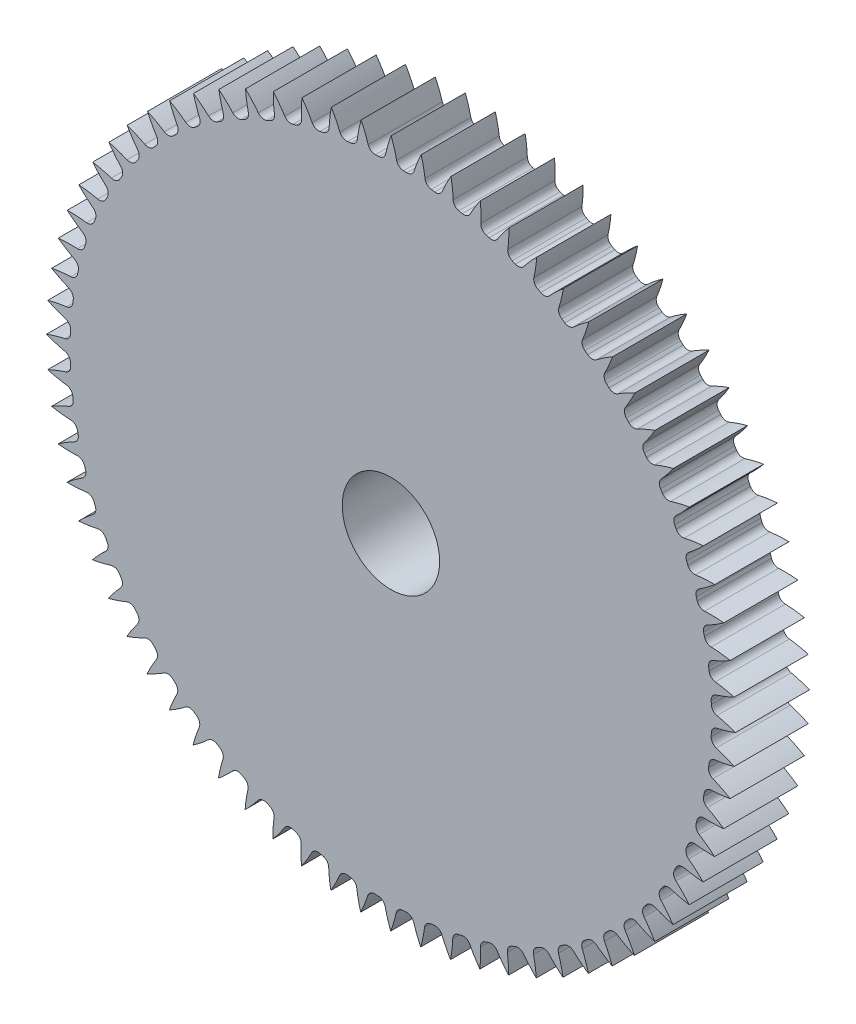
from build123d import *

# Parameters (mm, degrees)
SKETCH3_R             = 156.65
GEARBODY_DEPTH        = 25.4
TOOTHCUT_DEPTH        = 223.987903259
CIRPATTERN1_OUTLINE_R = 156.65
CIRPATTERN1_DEPTH     = 25.4
HUB1DIA_R             = 79.375
HUB1_DEPTH            = 17
BOREDIA_R             = 16.675100327
BORE_DEPTH            = 12700


# Read off the part's stored shape, not the designer's step: CirPattern1
with BuildPart() as part:
    # Sketch3 → gearBody (new body)
    with BuildSketch(Plane.XY):
        Circle(SKETCH3_R)
    extrude(amount=GEARBODY_DEPTH)

    # Sketch2 → toothCut (cut, through all)
    with BuildSketch(Plane.XY):
        with BuildLine():
            ThreePointArc((109.668319572, -5.460954122), (109.696421118, -4.863900865), (109.721272227, -4.266703485))
            ThreePointArc((109.721272227, -4.266703485), (110.294961179, -2.778743906), (111.659019101, -1.952615158))
            ThreePointArc((111.659019101, -1.952615158), (127.30239627, 4.746795303), (139.364241672, 16.751345908))
            ThreePointArc((139.364241672, 16.751345908), (140.229594831, -6.217731086), (137.334752586, -29.020082334))
            ThreePointArc((137.334752586, -29.020082334), (126.382707729, -15.9951039), (111.393653083, -7.937462149))
            ThreePointArc((111.393653083, -7.937462149), (110.108064896, -6.993849021), (109.668319572, -5.460954122))
        make_face()
    extrude(amount=TOOTHCUT_DEPTH, mode=Mode.SUBTRACT)

    # CirPattern1 outline → CirPattern1 (cut)
    with BuildSketch(Plane.XY):
        Circle(CIRPATTERN1_OUTLINE_R)
        with BuildLine():
            ThreePointArc((111.063941199, -11.676909612), (109.633072065, -12.381009209), (108.931881949, -13.813306366))
            ThreePointArc((108.931881949, -13.813306366), (108.855076224, -14.406065313), (108.775044994, -14.998397391))
            ThreePointArc((108.775044994, -14.998397391), (109.07951636, -16.563785493), (110.277971194, -17.615854281))
            ThreePointArc((110.277971194, -17.615854281), (113.276609926, -18.982931375), (116.167779807, -20.564661675))
            ThreePointArc((116.167779807, -20.564661675), (112.909314159, -21.057749544), (109.623599641, -21.312335734))
            ThreePointArc((109.623599641, -21.312335734), (108.136809072, -21.889047557), (107.313454274, -23.254781645))
            ThreePointArc((107.313454274, -23.254781645), (107.185278473, -23.838590906), (107.053926643, -24.4216938))
            ThreePointArc((107.053926643, -24.4216938), (107.220806841, -26.007661555), (108.323007355, -27.160179125))
            ThreePointArc((108.323007355, -27.160179125), (111.191086742, -28.783402664), (113.93339797, -30.611096061))
            ThreePointArc((113.93339797, -30.611096061), (110.644356328, -30.818313588), (107.348956297, -30.785562111))
            ThreePointArc((107.348956297, -30.785562111), (105.817559668, -31.230497036), (104.878306415, -32.519273994))
            ThreePointArc((104.878306415, -32.519273994), (104.699736032, -33.089690427), (104.518063269, -33.659126372))
            ThreePointArc((104.518063269, -33.659126372), (104.54608224, -35.253603609), (105.543640024, -36.497798606))
            ThreePointArc((105.543640024, -36.497798606), (108.259332249, -38.364814879), (110.83191418, -40.424561522))
            ThreePointArc((110.83191418, -40.424561522), (107.537328137, -40.344331657), (104.257322577, -40.024491772))
            ThreePointArc((104.257322577, -40.024491772), (102.692974741, -40.334263574), (101.644971317, -41.536275033))
            ThreePointArc((101.644971317, -41.536275033), (101.41736538, -42.088957424), (101.186754324, -42.640392669))
            ThreePointArc((101.186754324, -42.640392669), (101.075698827, -44.231244453), (101.961021863, -45.557647802))
            ThreePointArc((101.961021863, -45.557647802), (104.50365887, -47.654247687), (106.886932601, -49.930371662))
            ThreePointArc((106.886932601, -49.930371662), (103.611875946, -49.563305002), (100.37222768, -48.958810883))
            ThreePointArc((100.37222768, -48.958810883), (98.786834268, -49.131062013), (97.638056612, -50.237159938))
            ThreePointArc((97.638056612, -50.237159938), (97.36314734, -50.767902041), (97.085353081, -51.297139831))
            ThreePointArc((97.085353081, -51.297139831), (96.836068314, -52.872258819), (97.60241876, -54.27077579))
            ThreePointArc((97.60241876, -54.27077579), (99.952649545, -56.581002896), (102.128476924, -59.056181524))
            ThreePointArc((102.128476924, -59.056181524), (98.897874816, -58.405071668), (95.723239524, -57.520523882))
            ThreePointArc((95.723239524, -57.520523882), (94.128866337, -57.553943403), (92.888057341, -58.555709722))
            ThreePointArc((92.888057341, -58.555709722), (92.56793696, -59.060472269), (92.245073679, -59.563484784))
            ThreePointArc((92.245073679, -59.563484784), (91.859456851, -61.11088337), (92.501002316, -62.570870404))
            ThreePointArc((92.501002316, -62.570870404), (94.640940204, -65.077142509), (96.592761872, -67.732538186))
            ThreePointArc((96.592761872, -67.732538186), (93.431201143, -66.802340474), (90.345739716, -65.644470961))
            ThreePointArc((90.345739716, -65.644470961), (88.754520897, -65.538804532), (87.431123866, -66.428615198))
            ThreePointArc((87.431123866, -66.428615198), (87.068228685, -66.903556642), (86.702753567, -67.376515653))
            ThreePointArc((86.702753567, -67.376515653), (86.183739454, -68.8844172), (86.695597391, -70.394762914))
            ThreePointArc((86.695597391, -70.394762914), (88.608956162, -73.078005772), (90.321917577, -75.893409334))
            ThreePointArc((90.321917577, -75.893409334), (87.253459614, -74.691203131), (84.280654276, -73.26882398))
            ThreePointArc((84.280654276, -73.26882398), (82.704699962, -73.024875785), (81.308786747, -73.795958801))
            ThreePointArc((81.308786747, -73.795958801), (80.905878616, -74.23746455), (80.500573148, -74.676770555))
            ThreePointArc((80.500573148, -74.676770555), (79.852111761, -76.13369902), (80.230386622, -77.682908771))
            ThreePointArc((80.230386622, -77.682908771), (81.902604461, -80.522701285), (83.363668951, -83.476685811))
            ThreePointArc((83.363668951, -83.476685811), (80.411666572, -82.011620633), (77.574142168, -80.335557007))
            ThreePointArc((77.574142168, -80.335557007), (76.025446322, -79.95518364), (74.567640664, -80.601670599))
            ThreePointArc((74.567640664, -80.601670599), (74.127785959, -81.006380529), (73.685734759, -81.408690142))
            ThreePointArc((73.685734759, -81.408690142), (72.912761282, -82.803557421), (73.154574165, -84.379840787))
            ThreePointArc((73.154574165, -84.379840787), (74.572924485, -87.354570421), (75.770972469, -90.424654305))
            ThreePointArc((75.770972469, -90.424654305), (72.957892193, -88.707880183), (70.277243997, -86.790887937))
            ThreePointArc((70.277243997, -86.790887937), (68.767593129, -86.276984269), (67.258989811, -86.793955015))
            ThreePointArc((67.258989811, -86.793955015), (66.785536092, -87.158789038), (66.310103437, -87.521040441))
            ThreePointArc((66.310103437, -87.521040441), (65.418500663, -88.843230751), (65.522011228, -90.434591265))
            ThreePointArc((65.522011228, -90.434591265), (66.675699526, -93.52161853), (67.601613134, -96.68443658))
            ThreePointArc((67.601613134, -96.68443658), (64.948864202, -94.7290192), (62.445493564, -92.585687804))
            ThreePointArc((62.445493564, -92.585687804), (60.986377029, -91.942164952), (59.438457433, -92.325685026))
            ThreePointArc((59.438457433, -92.325685026), (58.935007968, -92.647866535), (58.429812188, -92.967302775))
            ThreePointArc((58.429812188, -92.967302775), (57.426365753, -94.20675345), (57.390786222, -95.801079897))
            ThreePointArc((57.390786222, -95.801079897), (58.271032233, -98.976910652), (58.917764704, -102.208391912))
            ThreePointArc((58.917764704, -102.208391912), (56.445536137, -100.029213183), (54.13849522, -97.675854683))
            ThreePointArc((54.13849522, -97.675854683), (52.741017777, -96.907610244), (51.165562505, -97.154760826))
            ThreePointArc((51.165562505, -97.154760826), (50.635948848, -97.431837825), (50.104834787, -97.706027801))
            ThreePointArc((50.104834787, -97.706027801), (48.997181525, -98.853305872), (48.822782679, -100.438464465))
            ThreePointArc((48.822782679, -100.438464465), (49.4228872, -103.67892872), (49.78551651, -106.954479668))
            ThreePointArc((49.78551651, -106.954479668), (47.512623459, -104.568124454), (45.419470237, -102.022649329))
            ThreePointArc((45.419470237, -102.022649329), (44.094267532, -101.135530107), (42.503266751, -101.244430233))
            ThreePointArc((42.503266751, -101.244430233), (41.951519582, -101.474293998), (41.39852934, -101.701150958))
            ThreePointArc((41.39852934, -101.701150958), (40.19509916, -102.747524947), (39.88320828, -104.311451672))
            ThreePointArc((39.88320828, -104.311451672), (40.198604154, -107.591887537), (40.274370473, -110.886579251))
            ThreePointArc((40.274370473, -110.886579251), (38.218111028, -108.311209158), (36.354775661, -105.59299001))
            ThreePointArc((36.354775661, -105.59299001), (35.111933287, -104.593747519), (33.517495473, -104.563568392))
            ThreePointArc((33.517495473, -104.563568392), (32.947813922, -104.744469522), (32.377156087, -104.922266947))
            ThreePointArc((32.377156087, -104.922266947), (31.087107821, -105.859773317), (30.640098584, -107.390565747))
            ThreePointArc((30.640098584, -107.390565747), (30.668385457, -110.686007125), (30.456712159, -113.974765012))
            ThreePointArc((30.456712159, -113.974765012), (28.632735695, -111.22998016), (27.013399291, -108.359704279))
            ThreePointArc((27.013399291, -108.359704279), (25.862376029, -107.255943357), (24.276635816, -107.086914659))
            ThreePointArc((24.276635816, -107.086914659), (23.693355503, -107.217476386), (23.109373127, -107.344861131))
            ThreePointArc((23.109373127, -107.344861131), (21.74252482, -108.166364891), (21.163799237, -109.652372772))
            ThreePointArc((21.163799237, -109.652372772), (20.904761828, -112.937739364), (20.407259875, -116.195533991))
            ThreePointArc((20.407259875, -116.195533991), (18.829447955, -113.302223851), (17.46643464, -110.301735769))
            ThreePointArc((17.46643464, -110.301735769), (16.415990472, -109.101856703), (14.851016302, -108.795264844))
            ThreePointArc((14.851016302, -108.795264844), (14.258576342, -108.874493516), (13.665713883, -108.950496106))
            ThreePointArc((13.665713883, -108.950496106), (12.232468076, -109.649745116), (11.526430598, -111.07965903))
            ThreePointArc((11.526430598, -111.07965903), (10.982040339, -114.329947213), (10.202496021, -117.531984796))
            ThreePointArc((10.202496021, -117.531984796), (8.882856746, -114.512169204), (7.786539876, -111.404304447))
            ThreePointArc((7.786539876, -111.404304447), (6.844669316, -110.117439042), (5.312371586, -109.675617371))
            ThreePointArc((5.312371586, -109.675617371), (4.715280805, -109.70291001), (4.118050305, -109.726952019))
            ThreePointArc((4.118050305, -109.726952019), (2.629314864, -110.298624572), (1.801338863, -111.661562012))
            ThreePointArc((1.801338863, -111.661562012), (0.975738893, -114.85203513), (-0.079914988, -117.973946228))
            ThreePointArc((-0.079914988, -117.973946228), (-1.131338367, -114.850607805), (-1.952615158, -111.659019101))
            ThreePointArc((-1.952615158, -111.659019101), (-2.778743906, -110.294961179), (-4.266703485, -109.721272227))
            ThreePointArc((-4.266703485, -109.721272227), (-4.863900865, -109.696421118), (-5.460954122, -109.668319572))
            ThreePointArc((-5.460954122, -109.668319572), (-6.993849021, -110.108064896), (-7.937462149, -111.393653083))
            ThreePointArc((-7.937462149, -111.393653083), (-9.037988516, -114.500029709), (-10.361717796, -117.518054695))
            ThreePointArc((-10.361717796, -117.518054695), (-11.136923311, -114.314963933), (-11.676909612, -111.063941199))
            ThreePointArc((-11.676909612, -111.063941199), (-12.381009209, -109.633072065), (-13.813306366, -108.931881949))
            ThreePointArc((-13.813306366, -108.931881949), (-14.406065313, -108.855076224), (-14.998397391, -108.775044994))
            ThreePointArc((-14.998397391, -108.775044994), (-16.563785493, -109.07951636), (-17.615854281, -110.277971194))
            ThreePointArc((-17.615854281, -110.277971194), (-18.982931375, -113.276609926), (-20.564661675, -116.167779807))
            ThreePointArc((-20.564661675, -116.167779807), (-21.057749544, -112.909314159), (-21.312335734, -109.623599641))
            ThreePointArc((-21.312335734, -109.623599641), (-21.889047557, -108.136809072), (-23.254781645, -107.313454274))
            ThreePointArc((-23.254781645, -107.313454274), (-23.838590906, -107.185278473), (-24.4216938, -107.053926643))
            ThreePointArc((-24.4216938, -107.053926643), (-26.007661555, -107.220806841), (-27.160179125, -108.323007355))
            ThreePointArc((-27.160179125, -108.323007355), (-28.783402664, -111.191086742), (-30.611096061, -113.93339797))
            ThreePointArc((-30.611096061, -113.93339797), (-30.818313588, -110.644356328), (-30.785562111, -107.348956297))
            ThreePointArc((-30.785562111, -107.348956297), (-31.230497036, -105.817559668), (-32.519273994, -104.878306415))
            ThreePointArc((-32.519273994, -104.878306415), (-33.089690427, -104.699736032), (-33.659126372, -104.518063269))
            ThreePointArc((-33.659126372, -104.518063269), (-35.253603609, -104.54608224), (-36.497798606, -105.543640024))
            ThreePointArc((-36.497798606, -105.543640024), (-38.364814879, -108.259332249), (-40.424561522, -110.83191418))
            ThreePointArc((-40.424561522, -110.83191418), (-40.344331657, -107.537328137), (-40.024491772, -104.257322577))
            ThreePointArc((-40.024491772, -104.257322577), (-40.334263574, -102.692974741), (-41.536275033, -101.644971317))
            ThreePointArc((-41.536275033, -101.644971317), (-42.088957424, -101.41736538), (-42.640392669, -101.186754324))
            ThreePointArc((-42.640392669, -101.186754324), (-44.231244453, -101.075698827), (-45.557647802, -101.961021863))
            ThreePointArc((-45.557647802, -101.961021863), (-47.654247687, -104.50365887), (-49.930371662, -106.886932601))
            ThreePointArc((-49.930371662, -106.886932601), (-49.563305002, -103.611875946), (-48.958810883, -100.37222768))
            ThreePointArc((-48.958810883, -100.37222768), (-49.131062013, -98.786834268), (-50.237159938, -97.638056612))
            ThreePointArc((-50.237159938, -97.638056612), (-50.767902041, -97.36314734), (-51.297139831, -97.085353081))
            ThreePointArc((-51.297139831, -97.085353081), (-52.872258819, -96.836068314), (-54.27077579, -97.60241876))
            ThreePointArc((-54.27077579, -97.60241876), (-56.581002896, -99.952649545), (-59.056181524, -102.128476924))
            ThreePointArc((-59.056181524, -102.128476924), (-58.405071668, -98.897874816), (-57.520523882, -95.723239524))
            ThreePointArc((-57.520523882, -95.723239524), (-57.553943403, -94.128866337), (-58.555709722, -92.888057341))
            ThreePointArc((-58.555709722, -92.888057341), (-59.060472269, -92.56793696), (-59.563484784, -92.245073679))
            ThreePointArc((-59.563484784, -92.245073679), (-61.11088337, -91.859456851), (-62.570870404, -92.501002316))
            ThreePointArc((-62.570870404, -92.501002316), (-65.077142509, -94.640940204), (-67.732538186, -96.592761872))
            ThreePointArc((-67.732538186, -96.592761872), (-66.802340474, -93.431201143), (-65.644470961, -90.345739716))
            ThreePointArc((-65.644470961, -90.345739716), (-65.538804532, -88.754520897), (-66.428615198, -87.431123866))
            ThreePointArc((-66.428615198, -87.431123866), (-66.903556642, -87.068228685), (-67.376515653, -86.702753567))
            ThreePointArc((-67.376515653, -86.702753567), (-68.8844172, -86.183739454), (-70.394762914, -86.695597391))
            ThreePointArc((-70.394762914, -86.695597391), (-73.078005772, -88.608956162), (-75.893409334, -90.321917577))
            ThreePointArc((-75.893409334, -90.321917577), (-74.691203131, -87.253459614), (-73.26882398, -84.280654276))
            ThreePointArc((-73.26882398, -84.280654276), (-73.024875785, -82.704699962), (-73.795958801, -81.308786747))
            ThreePointArc((-73.795958801, -81.308786747), (-74.23746455, -80.905878616), (-74.676770555, -80.500573148))
            ThreePointArc((-74.676770555, -80.500573148), (-76.13369902, -79.852111761), (-77.682908771, -80.230386622))
            ThreePointArc((-77.682908771, -80.230386622), (-80.522701285, -81.902604461), (-83.476685811, -83.363668951))
            ThreePointArc((-83.476685811, -83.363668951), (-82.011620633, -80.411666572), (-80.335557007, -77.574142168))
            ThreePointArc((-80.335557007, -77.574142168), (-79.95518364, -76.025446322), (-80.601670599, -74.567640664))
            ThreePointArc((-80.601670599, -74.567640664), (-81.006380529, -74.127785959), (-81.408690142, -73.685734759))
            ThreePointArc((-81.408690142, -73.685734759), (-82.803557421, -72.912761282), (-84.379840787, -73.154574165))
            ThreePointArc((-84.379840787, -73.154574165), (-87.354570421, -74.572924485), (-90.424654305, -75.770972469))
            ThreePointArc((-90.424654305, -75.770972469), (-88.707880183, -72.957892193), (-86.790887937, -70.277243997))
            ThreePointArc((-86.790887937, -70.277243997), (-86.276984269, -68.767593129), (-86.793955015, -67.258989811))
            ThreePointArc((-86.793955015, -67.258989811), (-87.158789038, -66.785536092), (-87.521040441, -66.310103437))
            ThreePointArc((-87.521040441, -66.310103437), (-88.843230751, -65.418500663), (-90.434591265, -65.522011228))
            ThreePointArc((-90.434591265, -65.522011228), (-93.52161853, -66.675699526), (-96.68443658, -67.601613134))
            ThreePointArc((-96.68443658, -67.601613134), (-94.7290192, -64.948864202), (-92.585687804, -62.445493564))
            ThreePointArc((-92.585687804, -62.445493564), (-91.942164952, -60.986377029), (-92.325685026, -59.438457433))
            ThreePointArc((-92.325685026, -59.438457433), (-92.647866535, -58.935007968), (-92.967302775, -58.429812188))
            ThreePointArc((-92.967302775, -58.429812188), (-94.20675345, -57.426365753), (-95.801079897, -57.390786222))
            ThreePointArc((-95.801079897, -57.390786222), (-98.976910652, -58.271032233), (-102.208391912, -58.917764704))
            ThreePointArc((-102.208391912, -58.917764704), (-100.029213183, -56.445536137), (-97.675854683, -54.13849522))
            ThreePointArc((-97.675854683, -54.13849522), (-96.907610244, -52.741017777), (-97.154760826, -51.165562505))
            ThreePointArc((-97.154760826, -51.165562505), (-97.431837825, -50.635948848), (-97.706027801, -50.104834787))
            ThreePointArc((-97.706027801, -50.104834787), (-98.853305872, -48.997181525), (-100.438464465, -48.822782679))
            ThreePointArc((-100.438464465, -48.822782679), (-103.67892872, -49.4228872), (-106.954479668, -49.78551651))
            ThreePointArc((-106.954479668, -49.78551651), (-104.568124454, -47.512623459), (-102.022649329, -45.419470237))
            ThreePointArc((-102.022649329, -45.419470237), (-101.135530107, -44.094267532), (-101.244430233, -42.503266751))
            ThreePointArc((-101.244430233, -42.503266751), (-101.474293998, -41.951519582), (-101.701150958, -41.39852934))
            ThreePointArc((-101.701150958, -41.39852934), (-102.747524947, -40.19509916), (-104.311451672, -39.88320828))
            ThreePointArc((-104.311451672, -39.88320828), (-107.591887537, -40.198604154), (-110.886579251, -40.274370473))
            ThreePointArc((-110.886579251, -40.274370473), (-108.311209158, -38.218111028), (-105.59299001, -36.354775661))
            ThreePointArc((-105.59299001, -36.354775661), (-104.593747519, -35.111933287), (-104.563568392, -33.517495473))
            ThreePointArc((-104.563568392, -33.517495473), (-104.744469522, -32.947813922), (-104.922266947, -32.377156087))
            ThreePointArc((-104.922266947, -32.377156087), (-105.859773317, -31.087107821), (-107.390565747, -30.640098584))
            ThreePointArc((-107.390565747, -30.640098584), (-110.686007125, -30.668385457), (-113.974765012, -30.456712159))
            ThreePointArc((-113.974765012, -30.456712159), (-111.22998016, -28.632735695), (-108.359704279, -27.013399291))
            ThreePointArc((-108.359704279, -27.013399291), (-107.255943357, -25.862376029), (-107.086914659, -24.276635816))
            ThreePointArc((-107.086914659, -24.276635816), (-107.217476386, -23.693355503), (-107.344861131, -23.109373127))
            ThreePointArc((-107.344861131, -23.109373127), (-108.166364891, -21.74252482), (-109.652372772, -21.163799237))
            ThreePointArc((-109.652372772, -21.163799237), (-112.937739364, -20.904761828), (-116.195533991, -20.407259875))
            ThreePointArc((-116.195533991, -20.407259875), (-113.302223851, -18.829447955), (-110.301735769, -17.46643464))
            ThreePointArc((-110.301735769, -17.46643464), (-109.101856703, -16.415990472), (-108.795264844, -14.851016302))
            ThreePointArc((-108.795264844, -14.851016302), (-108.874493516, -14.258576342), (-108.950496106, -13.665713883))
            ThreePointArc((-108.950496106, -13.665713883), (-109.649745116, -12.232468076), (-111.07965903, -11.526430598))
            ThreePointArc((-111.07965903, -11.526430598), (-114.329947213, -10.982040339), (-117.531984796, -10.202496021))
            ThreePointArc((-117.531984796, -10.202496021), (-114.512169204, -8.882856746), (-111.404304447, -7.786539876))
            ThreePointArc((-111.404304447, -7.786539876), (-110.117439042, -6.844669316), (-109.675617371, -5.312371586))
            ThreePointArc((-109.675617371, -5.312371586), (-109.70291001, -4.715280805), (-109.726952019, -4.118050305))
            ThreePointArc((-109.726952019, -4.118050305), (-110.298624572, -2.629314864), (-111.661562012, -1.801338863))
            ThreePointArc((-111.661562012, -1.801338863), (-114.85203513, -0.975738893), (-117.973946228, 0.079914988))
            ThreePointArc((-117.973946228, 0.079914988), (-114.850607805, 1.131338367), (-111.659019101, 1.952615158))
            ThreePointArc((-111.659019101, 1.952615158), (-110.294961179, 2.778743906), (-109.721272227, 4.266703485))
            ThreePointArc((-109.721272227, 4.266703485), (-109.696421118, 4.863900865), (-109.668319572, 5.460954122))
            ThreePointArc((-109.668319572, 5.460954122), (-110.108064896, 6.993849021), (-111.393653083, 7.937462149))
            ThreePointArc((-111.393653083, 7.937462149), (-114.500029709, 9.037988516), (-117.518054695, 10.361717796))
            ThreePointArc((-117.518054695, 10.361717796), (-114.314963933, 11.136923311), (-111.063941199, 11.676909612))
            ThreePointArc((-111.063941199, 11.676909612), (-109.633072065, 12.381009209), (-108.931881949, 13.813306366))
            ThreePointArc((-108.931881949, 13.813306366), (-108.855076224, 14.406065313), (-108.775044994, 14.998397391))
            ThreePointArc((-108.775044994, 14.998397391), (-109.07951636, 16.563785493), (-110.277971194, 17.615854281))
            ThreePointArc((-110.277971194, 17.615854281), (-113.276609926, 18.982931375), (-116.167779807, 20.564661675))
            ThreePointArc((-116.167779807, 20.564661675), (-112.909314159, 21.057749544), (-109.623599641, 21.312335734))
            ThreePointArc((-109.623599641, 21.312335734), (-108.136809072, 21.889047557), (-107.313454274, 23.254781645))
            ThreePointArc((-107.313454274, 23.254781645), (-107.185278473, 23.838590906), (-107.053926643, 24.4216938))
            ThreePointArc((-107.053926643, 24.4216938), (-107.220806841, 26.007661555), (-108.323007355, 27.160179125))
            ThreePointArc((-108.323007355, 27.160179125), (-111.191086742, 28.783402664), (-113.93339797, 30.611096061))
            ThreePointArc((-113.93339797, 30.611096061), (-110.644356328, 30.818313588), (-107.348956297, 30.785562111))
            ThreePointArc((-107.348956297, 30.785562111), (-105.817559668, 31.230497036), (-104.878306415, 32.519273994))
            ThreePointArc((-104.878306415, 32.519273994), (-104.699736032, 33.089690427), (-104.518063269, 33.659126372))
            ThreePointArc((-104.518063269, 33.659126372), (-104.54608224, 35.253603609), (-105.543640024, 36.497798606))
            ThreePointArc((-105.543640024, 36.497798606), (-108.259332249, 38.364814879), (-110.83191418, 40.424561522))
            ThreePointArc((-110.83191418, 40.424561522), (-107.537328137, 40.344331657), (-104.257322577, 40.024491772))
            ThreePointArc((-104.257322577, 40.024491772), (-102.692974741, 40.334263574), (-101.644971317, 41.536275033))
            ThreePointArc((-101.644971317, 41.536275033), (-101.41736538, 42.088957424), (-101.186754324, 42.640392669))
            ThreePointArc((-101.186754324, 42.640392669), (-101.075698827, 44.231244453), (-101.961021863, 45.557647802))
            ThreePointArc((-101.961021863, 45.557647802), (-104.50365887, 47.654247687), (-106.886932601, 49.930371662))
            ThreePointArc((-106.886932601, 49.930371662), (-103.611875946, 49.563305002), (-100.37222768, 48.958810883))
            ThreePointArc((-100.37222768, 48.958810883), (-98.786834268, 49.131062013), (-97.638056612, 50.237159938))
            ThreePointArc((-97.638056612, 50.237159938), (-97.36314734, 50.767902041), (-97.085353081, 51.297139831))
            ThreePointArc((-97.085353081, 51.297139831), (-96.836068314, 52.872258819), (-97.60241876, 54.27077579))
            ThreePointArc((-97.60241876, 54.27077579), (-99.952649545, 56.581002896), (-102.128476924, 59.056181524))
            ThreePointArc((-102.128476924, 59.056181524), (-98.897874816, 58.405071668), (-95.723239524, 57.520523882))
            ThreePointArc((-95.723239524, 57.520523882), (-94.128866337, 57.553943403), (-92.888057341, 58.555709722))
            ThreePointArc((-92.888057341, 58.555709722), (-92.56793696, 59.060472269), (-92.245073679, 59.563484784))
            ThreePointArc((-92.245073679, 59.563484784), (-91.859456851, 61.11088337), (-92.501002316, 62.570870404))
            ThreePointArc((-92.501002316, 62.570870404), (-94.640940204, 65.077142509), (-96.592761872, 67.732538186))
            ThreePointArc((-96.592761872, 67.732538186), (-93.431201143, 66.802340474), (-90.345739716, 65.644470961))
            ThreePointArc((-90.345739716, 65.644470961), (-88.754520897, 65.538804532), (-87.431123866, 66.428615198))
            ThreePointArc((-87.431123866, 66.428615198), (-87.068228685, 66.903556642), (-86.702753567, 67.376515653))
            ThreePointArc((-86.702753567, 67.376515653), (-86.183739454, 68.8844172), (-86.695597391, 70.394762914))
            ThreePointArc((-86.695597391, 70.394762914), (-88.608956162, 73.078005772), (-90.321917577, 75.893409334))
            ThreePointArc((-90.321917577, 75.893409334), (-87.253459614, 74.691203131), (-84.280654276, 73.26882398))
            ThreePointArc((-84.280654276, 73.26882398), (-82.704699962, 73.024875785), (-81.308786747, 73.795958801))
            ThreePointArc((-81.308786747, 73.795958801), (-80.905878616, 74.23746455), (-80.500573148, 74.676770555))
            ThreePointArc((-80.500573148, 74.676770555), (-79.852111761, 76.13369902), (-80.230386622, 77.682908771))
            ThreePointArc((-80.230386622, 77.682908771), (-81.902604461, 80.522701285), (-83.363668951, 83.476685811))
            ThreePointArc((-83.363668951, 83.476685811), (-80.411666572, 82.011620633), (-77.574142168, 80.335557007))
            ThreePointArc((-77.574142168, 80.335557007), (-76.025446322, 79.95518364), (-74.567640664, 80.601670599))
            ThreePointArc((-74.567640664, 80.601670599), (-74.127785959, 81.006380529), (-73.685734759, 81.408690142))
            ThreePointArc((-73.685734759, 81.408690142), (-72.912761282, 82.803557421), (-73.154574165, 84.379840787))
            ThreePointArc((-73.154574165, 84.379840787), (-74.572924485, 87.354570421), (-75.770972469, 90.424654305))
            ThreePointArc((-75.770972469, 90.424654305), (-72.957892193, 88.707880183), (-70.277243997, 86.790887937))
            ThreePointArc((-70.277243997, 86.790887937), (-68.767593129, 86.276984269), (-67.258989811, 86.793955015))
            ThreePointArc((-67.258989811, 86.793955015), (-66.785536092, 87.158789038), (-66.310103437, 87.521040441))
            ThreePointArc((-66.310103437, 87.521040441), (-65.418500663, 88.843230751), (-65.522011228, 90.434591265))
            ThreePointArc((-65.522011228, 90.434591265), (-66.675699526, 93.52161853), (-67.601613134, 96.68443658))
            ThreePointArc((-67.601613134, 96.68443658), (-64.948864202, 94.7290192), (-62.445493564, 92.585687804))
            ThreePointArc((-62.445493564, 92.585687804), (-60.986377029, 91.942164952), (-59.438457433, 92.325685026))
            ThreePointArc((-59.438457433, 92.325685026), (-58.935007968, 92.647866535), (-58.429812188, 92.967302775))
            ThreePointArc((-58.429812188, 92.967302775), (-57.426365753, 94.20675345), (-57.390786222, 95.801079897))
            ThreePointArc((-57.390786222, 95.801079897), (-58.271032233, 98.976910652), (-58.917764704, 102.208391912))
            ThreePointArc((-58.917764704, 102.208391912), (-56.445536137, 100.029213183), (-54.13849522, 97.675854683))
            ThreePointArc((-54.13849522, 97.675854683), (-52.741017777, 96.907610244), (-51.165562505, 97.154760826))
            ThreePointArc((-51.165562505, 97.154760826), (-50.635948848, 97.431837825), (-50.104834787, 97.706027801))
            ThreePointArc((-50.104834787, 97.706027801), (-48.997181525, 98.853305872), (-48.822782679, 100.438464465))
            ThreePointArc((-48.822782679, 100.438464465), (-49.4228872, 103.67892872), (-49.78551651, 106.954479668))
            ThreePointArc((-49.78551651, 106.954479668), (-47.512623459, 104.568124454), (-45.419470237, 102.022649329))
            ThreePointArc((-45.419470237, 102.022649329), (-44.094267532, 101.135530107), (-42.503266751, 101.244430233))
            ThreePointArc((-42.503266751, 101.244430233), (-41.951519582, 101.474293998), (-41.39852934, 101.701150958))
            ThreePointArc((-41.39852934, 101.701150958), (-40.19509916, 102.747524947), (-39.88320828, 104.311451672))
            ThreePointArc((-39.88320828, 104.311451672), (-40.198604154, 107.591887537), (-40.274370473, 110.886579251))
            ThreePointArc((-40.274370473, 110.886579251), (-38.218111028, 108.311209158), (-36.354775661, 105.59299001))
            ThreePointArc((-36.354775661, 105.59299001), (-35.111933287, 104.593747519), (-33.517495473, 104.563568392))
            ThreePointArc((-33.517495473, 104.563568392), (-32.947813922, 104.744469522), (-32.377156087, 104.922266947))
            ThreePointArc((-32.377156087, 104.922266947), (-31.087107821, 105.859773317), (-30.640098584, 107.390565747))
            ThreePointArc((-30.640098584, 107.390565747), (-30.668385457, 110.686007125), (-30.456712159, 113.974765012))
            ThreePointArc((-30.456712159, 113.974765012), (-28.632735695, 111.22998016), (-27.013399291, 108.359704279))
            ThreePointArc((-27.013399291, 108.359704279), (-25.862376029, 107.255943357), (-24.276635816, 107.086914659))
            ThreePointArc((-24.276635816, 107.086914659), (-23.693355503, 107.217476386), (-23.109373127, 107.344861131))
            ThreePointArc((-23.109373127, 107.344861131), (-21.74252482, 108.166364891), (-21.163799237, 109.652372772))
            ThreePointArc((-21.163799237, 109.652372772), (-20.904761828, 112.937739364), (-20.407259875, 116.195533991))
            ThreePointArc((-20.407259875, 116.195533991), (-18.829447955, 113.302223851), (-17.46643464, 110.301735769))
            ThreePointArc((-17.46643464, 110.301735769), (-16.415990472, 109.101856703), (-14.851016302, 108.795264844))
            ThreePointArc((-14.851016302, 108.795264844), (-14.258576342, 108.874493516), (-13.665713883, 108.950496106))
            ThreePointArc((-13.665713883, 108.950496106), (-12.232468076, 109.649745116), (-11.526430598, 111.07965903))
            ThreePointArc((-11.526430598, 111.07965903), (-10.982040339, 114.329947213), (-10.202496021, 117.531984796))
            ThreePointArc((-10.202496021, 117.531984796), (-8.882856746, 114.512169204), (-7.786539876, 111.404304447))
            ThreePointArc((-7.786539876, 111.404304447), (-6.844669316, 110.117439042), (-5.312371586, 109.675617371))
            ThreePointArc((-5.312371586, 109.675617371), (-4.715280805, 109.70291001), (-4.118050305, 109.726952019))
            ThreePointArc((-4.118050305, 109.726952019), (-2.629314864, 110.298624572), (-1.801338863, 111.661562012))
            ThreePointArc((-1.801338863, 111.661562012), (-0.975738893, 114.85203513), (0.079914988, 117.973946228))
            ThreePointArc((0.079914988, 117.973946228), (1.131338367, 114.850607805), (1.952615158, 111.659019101))
            ThreePointArc((1.952615158, 111.659019101), (2.778743906, 110.294961179), (4.266703485, 109.721272227))
            ThreePointArc((4.266703485, 109.721272227), (4.863900865, 109.696421118), (5.460954122, 109.668319572))
            ThreePointArc((5.460954122, 109.668319572), (6.993849021, 110.108064896), (7.937462149, 111.393653083))
            ThreePointArc((7.937462149, 111.393653083), (9.037988516, 114.500029709), (10.361717796, 117.518054695))
            ThreePointArc((10.361717796, 117.518054695), (11.136923311, 114.314963933), (11.676909612, 111.063941199))
            ThreePointArc((11.676909612, 111.063941199), (12.381009209, 109.633072065), (13.813306366, 108.931881949))
            ThreePointArc((13.813306366, 108.931881949), (14.406065313, 108.855076224), (14.998397391, 108.775044994))
            ThreePointArc((14.998397391, 108.775044994), (16.563785493, 109.07951636), (17.615854281, 110.277971194))
            ThreePointArc((17.615854281, 110.277971194), (18.982931375, 113.276609926), (20.564661675, 116.167779807))
            ThreePointArc((20.564661675, 116.167779807), (21.057749544, 112.909314159), (21.312335734, 109.623599641))
            ThreePointArc((21.312335734, 109.623599641), (21.889047557, 108.136809072), (23.254781645, 107.313454274))
            ThreePointArc((23.254781645, 107.313454274), (23.838590906, 107.185278473), (24.4216938, 107.053926643))
            ThreePointArc((24.4216938, 107.053926643), (26.007661555, 107.220806841), (27.160179125, 108.323007355))
            ThreePointArc((27.160179125, 108.323007355), (28.783402664, 111.191086742), (30.611096061, 113.93339797))
            ThreePointArc((30.611096061, 113.93339797), (30.818313588, 110.644356328), (30.785562111, 107.348956297))
            ThreePointArc((30.785562111, 107.348956297), (31.230497036, 105.817559668), (32.519273994, 104.878306415))
            ThreePointArc((32.519273994, 104.878306415), (33.089690427, 104.699736032), (33.659126372, 104.518063269))
            ThreePointArc((33.659126372, 104.518063269), (35.253603609, 104.54608224), (36.497798606, 105.543640024))
            ThreePointArc((36.497798606, 105.543640024), (38.364814879, 108.259332249), (40.424561522, 110.83191418))
            ThreePointArc((40.424561522, 110.83191418), (40.344331657, 107.537328137), (40.024491772, 104.257322577))
            ThreePointArc((40.024491772, 104.257322577), (40.334263574, 102.692974741), (41.536275033, 101.644971317))
            ThreePointArc((41.536275033, 101.644971317), (42.088957424, 101.41736538), (42.640392669, 101.186754324))
            ThreePointArc((42.640392669, 101.186754324), (44.231244453, 101.075698827), (45.557647802, 101.961021863))
            ThreePointArc((45.557647802, 101.961021863), (47.654247687, 104.50365887), (49.930371662, 106.886932601))
            ThreePointArc((49.930371662, 106.886932601), (49.563305002, 103.611875946), (48.958810883, 100.37222768))
            ThreePointArc((48.958810883, 100.37222768), (49.131062013, 98.786834268), (50.237159938, 97.638056612))
            ThreePointArc((50.237159938, 97.638056612), (50.767902041, 97.36314734), (51.297139831, 97.085353081))
            ThreePointArc((51.297139831, 97.085353081), (52.872258819, 96.836068314), (54.27077579, 97.60241876))
            ThreePointArc((54.27077579, 97.60241876), (56.581002896, 99.952649545), (59.056181524, 102.128476924))
            ThreePointArc((59.056181524, 102.128476924), (58.405071668, 98.897874816), (57.520523882, 95.723239524))
            ThreePointArc((57.520523882, 95.723239524), (57.553943403, 94.128866337), (58.555709722, 92.888057341))
            ThreePointArc((58.555709722, 92.888057341), (59.060472269, 92.56793696), (59.563484784, 92.245073679))
            ThreePointArc((59.563484784, 92.245073679), (61.11088337, 91.859456851), (62.570870404, 92.501002316))
            ThreePointArc((62.570870404, 92.501002316), (65.077142509, 94.640940204), (67.732538186, 96.592761872))
            ThreePointArc((67.732538186, 96.592761872), (66.802340474, 93.431201143), (65.644470961, 90.345739716))
            ThreePointArc((65.644470961, 90.345739716), (65.538804532, 88.754520897), (66.428615198, 87.431123866))
            ThreePointArc((66.428615198, 87.431123866), (66.903556642, 87.068228685), (67.376515653, 86.702753567))
            ThreePointArc((67.376515653, 86.702753567), (68.8844172, 86.183739454), (70.394762914, 86.695597391))
            ThreePointArc((70.394762914, 86.695597391), (73.078005772, 88.608956162), (75.893409334, 90.321917577))
            ThreePointArc((75.893409334, 90.321917577), (74.691203131, 87.253459614), (73.26882398, 84.280654276))
            ThreePointArc((73.26882398, 84.280654276), (73.024875785, 82.704699962), (73.795958801, 81.308786747))
            ThreePointArc((73.795958801, 81.308786747), (74.23746455, 80.905878616), (74.676770555, 80.500573148))
            ThreePointArc((74.676770555, 80.500573148), (76.13369902, 79.852111761), (77.682908771, 80.230386622))
            ThreePointArc((77.682908771, 80.230386622), (80.522701285, 81.902604461), (83.476685811, 83.363668951))
            ThreePointArc((83.476685811, 83.363668951), (82.011620633, 80.411666572), (80.335557007, 77.574142168))
            ThreePointArc((80.335557007, 77.574142168), (79.95518364, 76.025446322), (80.601670599, 74.567640664))
            ThreePointArc((80.601670599, 74.567640664), (81.006380529, 74.127785959), (81.408690142, 73.685734759))
            ThreePointArc((81.408690142, 73.685734759), (82.803557421, 72.912761282), (84.379840787, 73.154574165))
            ThreePointArc((84.379840787, 73.154574165), (87.354570421, 74.572924485), (90.424654305, 75.770972469))
            ThreePointArc((90.424654305, 75.770972469), (88.707880183, 72.957892193), (86.790887937, 70.277243997))
            ThreePointArc((86.790887937, 70.277243997), (86.276984269, 68.767593129), (86.793955015, 67.258989811))
            ThreePointArc((86.793955015, 67.258989811), (87.158789038, 66.785536092), (87.521040441, 66.310103437))
            ThreePointArc((87.521040441, 66.310103437), (88.843230751, 65.418500663), (90.434591265, 65.522011228))
            ThreePointArc((90.434591265, 65.522011228), (93.52161853, 66.675699526), (96.68443658, 67.601613134))
            ThreePointArc((96.68443658, 67.601613134), (94.7290192, 64.948864202), (92.585687804, 62.445493564))
            ThreePointArc((92.585687804, 62.445493564), (91.942164952, 60.986377029), (92.325685026, 59.438457433))
            ThreePointArc((92.325685026, 59.438457433), (92.647866535, 58.935007968), (92.967302775, 58.429812188))
            ThreePointArc((92.967302775, 58.429812188), (94.20675345, 57.426365753), (95.801079897, 57.390786222))
            ThreePointArc((95.801079897, 57.390786222), (98.976910652, 58.271032233), (102.208391912, 58.917764704))
            ThreePointArc((102.208391912, 58.917764704), (100.029213183, 56.445536137), (97.675854683, 54.13849522))
            ThreePointArc((97.675854683, 54.13849522), (96.907610244, 52.741017777), (97.154760826, 51.165562505))
            ThreePointArc((97.154760826, 51.165562505), (97.431837825, 50.635948848), (97.706027801, 50.104834787))
            ThreePointArc((97.706027801, 50.104834787), (98.853305872, 48.997181525), (100.438464465, 48.822782679))
            ThreePointArc((100.438464465, 48.822782679), (103.67892872, 49.4228872), (106.954479668, 49.78551651))
            ThreePointArc((106.954479668, 49.78551651), (104.568124454, 47.512623459), (102.022649329, 45.419470237))
            ThreePointArc((102.022649329, 45.419470237), (101.135530107, 44.094267532), (101.244430233, 42.503266751))
            ThreePointArc((101.244430233, 42.503266751), (101.474293998, 41.951519582), (101.701150958, 41.39852934))
            ThreePointArc((101.701150958, 41.39852934), (102.747524947, 40.19509916), (104.311451672, 39.88320828))
            ThreePointArc((104.311451672, 39.88320828), (107.591887537, 40.198604154), (110.886579251, 40.274370473))
            ThreePointArc((110.886579251, 40.274370473), (108.311209158, 38.218111028), (105.59299001, 36.354775661))
            ThreePointArc((105.59299001, 36.354775661), (104.593747519, 35.111933287), (104.563568392, 33.517495473))
            ThreePointArc((104.563568392, 33.517495473), (104.744469522, 32.947813922), (104.922266947, 32.377156087))
            ThreePointArc((104.922266947, 32.377156087), (105.859773317, 31.087107821), (107.390565747, 30.640098584))
            ThreePointArc((107.390565747, 30.640098584), (110.686007125, 30.668385457), (113.974765012, 30.456712159))
            ThreePointArc((113.974765012, 30.456712159), (111.22998016, 28.632735695), (108.359704279, 27.013399291))
            ThreePointArc((108.359704279, 27.013399291), (107.255943357, 25.862376029), (107.086914659, 24.276635816))
            ThreePointArc((107.086914659, 24.276635816), (107.217476386, 23.693355503), (107.344861131, 23.109373127))
            ThreePointArc((107.344861131, 23.109373127), (108.166364891, 21.74252482), (109.652372772, 21.163799237))
            ThreePointArc((109.652372772, 21.163799237), (112.937739364, 20.904761828), (116.195533991, 20.407259875))
            ThreePointArc((116.195533991, 20.407259875), (113.302223851, 18.829447955), (110.301735769, 17.46643464))
            ThreePointArc((110.301735769, 17.46643464), (109.101856703, 16.415990472), (108.795264844, 14.851016302))
            ThreePointArc((108.795264844, 14.851016302), (108.874493516, 14.258576342), (108.950496106, 13.665713883))
            ThreePointArc((108.950496106, 13.665713883), (109.649745116, 12.232468076), (111.07965903, 11.526430598))
            ThreePointArc((111.07965903, 11.526430598), (114.329947213, 10.982040339), (117.531984796, 10.202496021))
            ThreePointArc((117.531984796, 10.202496021), (114.512169204, 8.882856746), (111.404304447, 7.786539876))
            ThreePointArc((111.404304447, 7.786539876), (110.117439042, 6.844669316), (109.675617371, 5.312371586))
            ThreePointArc((109.675617371, 5.312371586), (109.70291001, 4.715280805), (109.726952019, 4.118050305))
            ThreePointArc((109.726952019, 4.118050305), (110.298624572, 2.629314864), (111.661562012, 1.801338863))
            ThreePointArc((111.661562012, 1.801338863), (114.85203513, 0.975738893), (117.973946228, -0.079914988))
            ThreePointArc((117.973946228, -0.079914988), (129.964813863, 6.689027674), (139.364241672, 16.751345908))
            ThreePointArc((139.364241672, 16.751345908), (140.229594831, -6.217731086), (137.334752586, -29.020082334))
            ThreePointArc((137.334752586, -29.020082334), (128.86277936, -18.165352441), (117.518054695, -10.361717796))
            ThreePointArc((117.518054695, -10.361717796), (114.314963933, -11.136923311), (111.063941199, -11.676909612))
        make_face(mode=Mode.SUBTRACT)
    extrude(amount=CIRPATTERN1_DEPTH, mode=Mode.SUBTRACT)

    # hub1Dia → hub1 (add)
    with BuildSketch(Plane(origin=(0, 0, 0), x_dir=(-1, 0, 0), z_dir=(0, 0, -1))):
        with Locations(Location((0, 0, 0), (0, 0, 180))):
            Circle(HUB1DIA_R)
    extrude(amount=HUB1_DEPTH)

    # boreDia → bore (cut, symmetric)
    with BuildSketch(Plane.XY):
        Circle(BOREDIA_R)
    extrude(amount=BORE_DEPTH, both=True, mode=Mode.SUBTRACT)


solid = part.part
